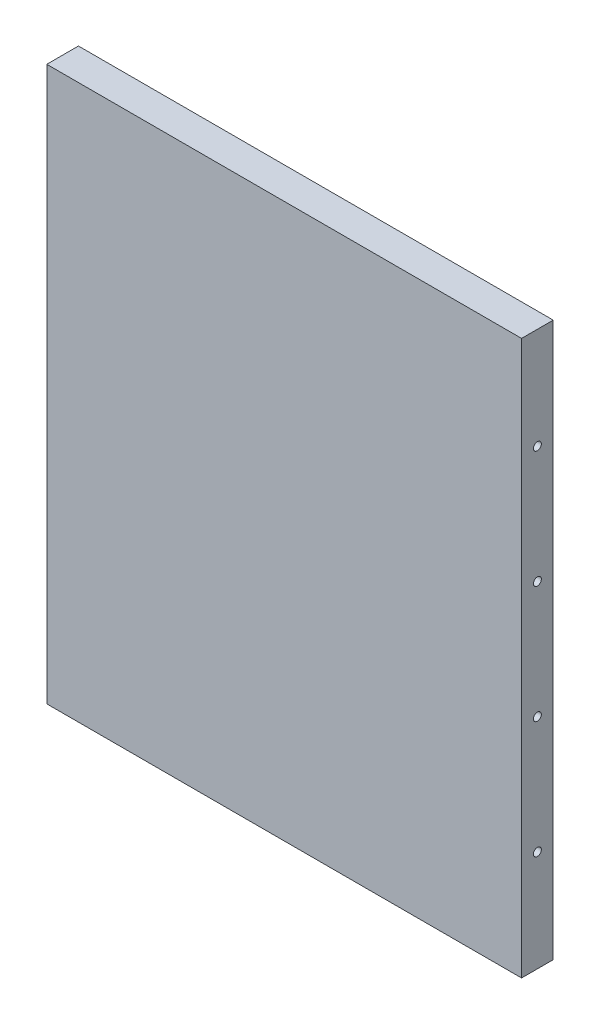
from build123d import *

# Parameters (mm, degrees)
SKIZZE1_W                       = 150
SKIZZE1_H                       = 175
AUFSATZ_LINEAR_AUSTRAGEN1_DEPTH = 10
SKIZZE2_R                       = 1.25
SCHNITT_LINEAR_AUSTRAGEN1_DEPTH = 5
SCHNITT_LINEAR_START            = -5
SKIZZE3_R                       = 1.25
SCHNITT_LINEAR_AUSTRAGEN2_DEPTH = 5


with BuildPart() as part:
    # Skizze1 → Aufsatz-Linear austragen1 (new body)
    with BuildSketch(Plane.XY):
        with Locations((-9.70090245, -21.923076923)):
            Rectangle(SKIZZE1_W, SKIZZE1_H)
    extrude(amount=AUFSATZ_LINEAR_AUSTRAGEN1_DEPTH)

    # Skizze2 → Schnitt-Linear austragen1 (cut)
    with BuildSketch(Plane.ZY.offset(84.70090245)):
        with Locations((5, 33.576923077)):
            Circle(SKIZZE2_R)
        with Locations((5, -3.423076923)):
            Circle(SKIZZE2_R)
        with Locations((5, -40.423076923)):
            Circle(SKIZZE2_R)
        with Locations((5, -77.423076923)):
            Circle(SKIZZE2_R)
    extrude(amount=-SCHNITT_LINEAR_AUSTRAGEN1_DEPTH, mode=Mode.SUBTRACT)

    # Skizze3 → Schnitt-Linear austragen2 (cut)
    with BuildSketch(Plane(origin=(65.29909755, 0, 0), x_dir=(0, 0, -1), z_dir=(1, 0, 0)).offset(SCHNITT_LINEAR_START)):
        with Locations((-5, 33.576923077)):
            Circle(SKIZZE3_R)
        with Locations((-5, -3.423076923)):
            Circle(SKIZZE3_R)
        with Locations((-5, -40.423076923)):
            Circle(SKIZZE3_R)
        with Locations((-5, -77.423076923)):
            Circle(SKIZZE3_R)
    extrude(amount=SCHNITT_LINEAR_AUSTRAGEN2_DEPTH, mode=Mode.SUBTRACT)


solid = part.part
